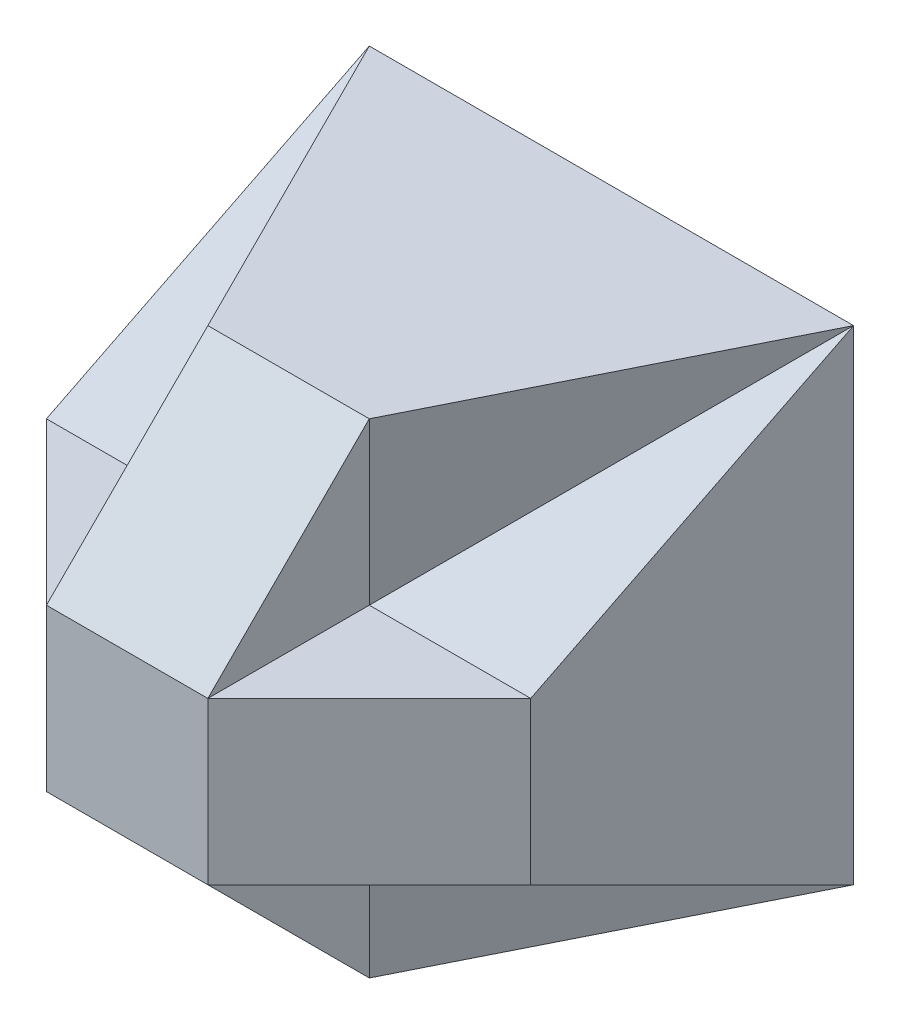
from build123d import *

# Parameters (mm, degrees)
SKETCH_1_W               = 9
SKETCH_1_H               = 9
EXTRUDE_2_DEPTH          = 3
SKETCH_4_W               = 3
SKETCH_4_H               = 3
EXTRUDE_3_DEPTH          = 3
MIRROR_2_DEPTH           = 2.683281573
MIRROR_2_DRAFT           = 11.536959
MIRROR_2_2_DEPTH         = 2.683281573
MIRROR_2_2_DRAFT         = 11.536959
EXTRUDE_4_DEPTH          = 3
PATTERN_CIRCULAR_1_COUNT = 4


# Read off the part's stored shape, not the designer's step: 镜向2
with BuildPart() as part:
    # 草图1 → 凸台-拉伸2 (new, symmetric)
    with BuildSketch(Plane.XY):
        Rectangle(SKETCH_1_W, SKETCH_1_H)
    extrude(amount=EXTRUDE_2_DEPTH, both=True)

    # 草图4 → 凸台-拉伸3 (add)
    with BuildSketch(Plane.XY.offset(3)):
        Rectangle(SKETCH_4_W, SKETCH_4_H)
    extrude(amount=EXTRUDE_3_DEPTH)

    # 草图5 → 切除-放样1 section 0
    with BuildSketch(Plane.XY.offset(3), mode=Mode.PRIVATE) as loft_1_s0:
        with BuildLine():
            Line((1.5, -1.5), (4.5, -1.5))
            Line((4.5, -1.5), (4.5, -4.5))
            Line((4.5, -4.5), (1.5, -4.5))
            Line((1.5, -4.5), (1.5, -1.5))
        make_face()
    loft_1 = loft([Vertex(4.5, -4.5, -3), loft_1_s0.sketch], mode=Mode.SUBTRACT)

    # 镜向1: 切除-放样1 across plane
    add(loft_1.mirror(Plane.ZX), mode=Mode.SUBTRACT)


with BuildPart() as mirror_2_tool:
    # 镜向2 outline → 镜向2 (with draft: the straight prism first)
    with BuildSketch(Plane(origin=(-2.4, 0, 1.2), x_dir=(0.4472135954999576, 0, 0.8944271909999161), z_dir=(0.894427190999916, 0, -0.447213595499958))):
        Polygon((-4.695742753, 4.5), (2.01246118, 1.5), (2.01246118, 4.5), align=None)
    extrude(amount=-MIRROR_2_DEPTH)
    # 镜向2: the draft: its side faces are tilted about the plane it starts from
    mirror_2_sides = [mirror_2_tool.faces().sort_by_distance(p)[0] for p in [
        (-4.2, -3, 0.6),
        (-2.7, -3, 3.6),
        (-4.2, -4.5, 0.6),
    ]]
    draft(mirror_2_sides, Plane(origin=(-2.4, 0, 1.2), x_dir=(0.4472135954999576, 0, 0.8944271909999161), z_dir=(0.894427190999916, 0, -0.447213595499958)), MIRROR_2_DRAFT)


with BuildPart() as part_1:
    add(part.part)

    # 镜向2: cut by mirror_2_tool
    add(mirror_2_tool.part, mode=Mode.SUBTRACT)


with BuildPart() as mirror_2_2_tool:
    # Mirror 2 2 outline → Mirror 2 2 (with draft: the straight prism first)
    with BuildSketch(Plane(origin=(-2.4, 0, 1.2), x_dir=(0.4472135954999576, 0, 0.8944271909999161), z_dir=(0.894427190999916, 0, -0.447213595499958))):
        Polygon((2.01246118, -4.5), (2.01246118, -1.5), (-4.695742753, -4.5), align=None)
    extrude(amount=-MIRROR_2_2_DEPTH)
    # Mirror 2 2: the draft: its side faces are tilted about the plane it starts from
    mirror_2_2_sides = [mirror_2_2_tool.faces().sort_by_distance(p)[0] for p in [
        (-2.7, 3, 3.6),
        (-4.2, 3, 0.6),
        (-4.2, 4.5, 0.6),
    ]]
    draft(mirror_2_2_sides, Plane(origin=(-2.4, 0, 1.2), x_dir=(0.4472135954999576, 0, 0.8944271909999161), z_dir=(0.894427190999916, 0, -0.447213595499958)), MIRROR_2_2_DRAFT)


with BuildPart() as part_2:
    add(part_1.part)

    # Mirror 2 2: cut by mirror_2_2_tool
    add(mirror_2_2_tool.part, mode=Mode.SUBTRACT)

    # 草图7 → 凸台-拉伸4 (add)
    with BuildSketch(Plane.XZ.offset(1.5)):
        Polygon((1.5, 6), (4.5, 3), (1.5, 3), align=None)
    extrude_4 = extrude(amount=-EXTRUDE_4_DEPTH)

    # 阵列(圆周)1: 凸台-拉伸4 ×4 about axis
    pattern_circular_1_axis = Axis((0, 0, 0), (0, 0, 1))
    for i in range(1, PATTERN_CIRCULAR_1_COUNT):
        add(extrude_4.rotate(pattern_circular_1_axis, i * 360 / PATTERN_CIRCULAR_1_COUNT))


solid = part_2.part
